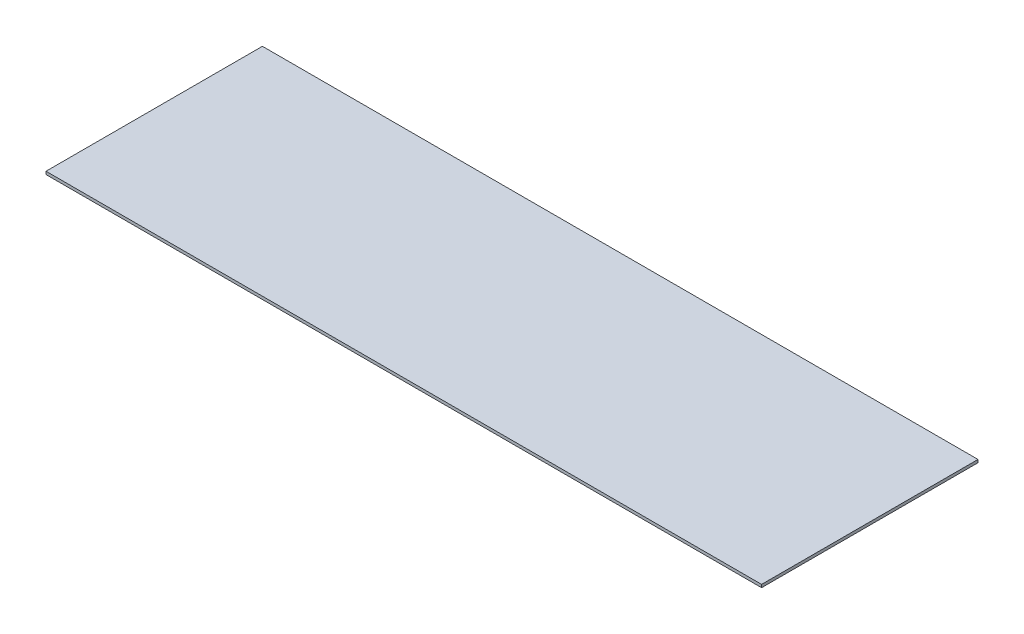
from build123d import *

# Parameters (mm, degrees)
SKIZZE1_W                       = 992
SKIZZE1_H                       = 4
AUFSATZ_LINEAR_AUSTRAGEN1_DEPTH = 300


with BuildPart() as part:
    # Skizze1 → Aufsatz-Linear austragen1 (new body)
    with BuildSketch(Plane.XY):
        with Locations((0, 2)):
            Rectangle(SKIZZE1_W, SKIZZE1_H)
    extrude(amount=AUFSATZ_LINEAR_AUSTRAGEN1_DEPTH)


solid = part.part
